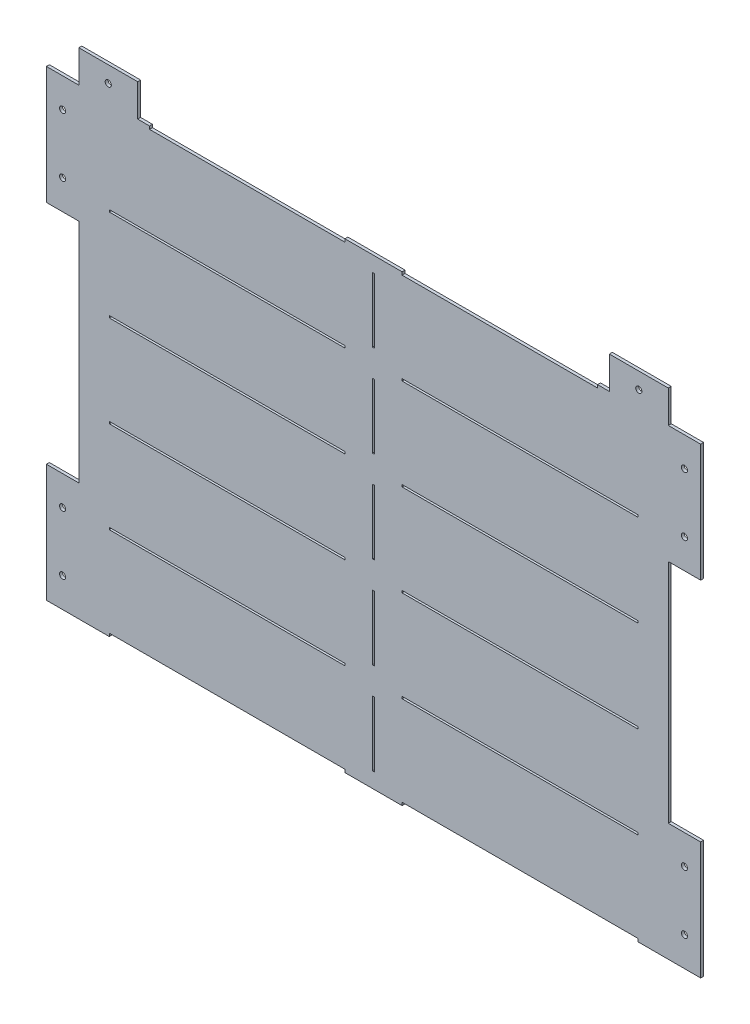
from build123d import *

# Parameters (mm, degrees)
MASTER_SKETCH_W         = 635.3556
MASTER_SKETCH_H         = 498.348
BOSS_EXTRUDE1_DEPTH     = 3.175
SKETCH2_W               = 34.925
SKETCH2_H               = 127
BOSS_EXTRUDE2_DEPTH     = 3.175
M6_CLEARANCE_HOLE1_D    = 6.6
MIRROR7_COPY_1_SKETCH_W = 34.925
MIRROR7_COPY_1_SKETCH_H = 127
MIRROR7_COPY_1_DEPTH    = 3.175
MIRROR7_COPY_2_D        = 6.6
SKETCH5_W               = 2.286
SKETCH5_H               = 69.85
CUT_EXTRUDE1_DEPTH      = 432.771348596
LPATTERN1_COUNT         = 5
LPATTERN1_PITCH         = 98.8568
SKETCH7_W               = 254
SKETCH7_H               = 2.286
CUT_EXTRUDE3_DEPTH      = 432.771348596
LPATTERN2_COUNT         = 4
LPATTERN2_PITCH         = 98.8568
MIRROR4_COPY_1_SKETCH_W = 254
MIRROR4_COPY_1_SKETCH_H = 2.286
MIRROR4_COPY_1_DEPTH    = 432.771348596
MIRROR4_COPY_2_SKETCH_W = 254
MIRROR4_COPY_2_SKETCH_H = 2.286
MIRROR4_COPY_2_DEPTH    = 432.771348596
MIRROR4_COPY_3_SKETCH_W = 254
MIRROR4_COPY_3_SKETCH_H = 2.286
MIRROR4_COPY_3_DEPTH    = 432.771348596
SKETCH10_W              = 63.5
SKETCH10_H              = 34.925
SKETCH10_R              = 3
BOSS_EXTRUDE3_DEPTH     = 3.175
M6_CLEARANCE_HOLE2_D    = 6.6
SKETCH6_W               = 210.6549
SKETCH6_H               = 3.175
SKETCH6_W_2             = 254
CUT_EXTRUDE2_DEPTH      = 453.825636414


with BuildPart() as part:
    # Master Sketch → Boss-Extrude1 (new body)
    with BuildSketch(Plane.XY):
        Rectangle(MASTER_SKETCH_W, MASTER_SKETCH_H)
    extrude(amount=BOSS_EXTRUDE1_DEPTH)

    # Sketch2 → Boss-Extrude2 (add)
    with BuildSketch(Plane.XY.offset(3.175)):
        with Locations((-335.1403, -185.674)):
            Rectangle(SKETCH2_W, SKETCH2_H)
    boss_extrude2 = extrude(amount=-BOSS_EXTRUDE2_DEPTH)

    # M6 Clearance Hole1 (through all)
    with Locations(Plane.XY.offset(3.175)):
        with Locations((-335.1403, -217.424), (-335.1403, -153.924)):
            m6_clearance_hole1 = Hole(M6_CLEARANCE_HOLE1_D / 2)

    # Mirror1: Boss-Extrude2, M6 Clearance Hole1 across plane
    add(boss_extrude2.mirror(Plane(origin=(0, 0, 0), x_dir=(0, 0, 1), z_dir=(1, 0, 0))))
    add(m6_clearance_hole1.mirror(Plane(origin=(0, 0, 0), x_dir=(0, 0, 1), z_dir=(1, 0, 0))), mode=Mode.SUBTRACT)

    # Mirror7: Boss-Extrude2, M6 Clearance Hole1 across plane
    add(boss_extrude2.mirror(Plane.ZX))
    add(m6_clearance_hole1.mirror(Plane.ZX), mode=Mode.SUBTRACT)

    # Mirror7 copy 1 sketch → Mirror7 copy 1 (add)
    with BuildSketch(Plane(origin=(0, 0, 3.175), x_dir=(-1, 0, 0), z_dir=(0, 0, 1))):
        with Locations((-335.1403, -185.674)):
            Rectangle(MIRROR7_COPY_1_SKETCH_W, MIRROR7_COPY_1_SKETCH_H)
    extrude(amount=-MIRROR7_COPY_1_DEPTH)

    # Mirror7 copy 2 (through all)
    with Locations(Plane(origin=(0, 0, 3.175), x_dir=(-1, 0, 0), z_dir=(0, 0, 1))):
        with Locations((-335.1403, -217.424), (-335.1403, -153.924)):
            Hole(MIRROR7_COPY_2_D / 2)

    # Sketch5 → Cut-Extrude1 (cut, through all)
    with BuildSketch(Plane.XY.offset(3.175)):
        with Locations((0, 197.7136)):
            Rectangle(SKETCH5_W, SKETCH5_H)
    cut_extrude1 = extrude(amount=-CUT_EXTRUDE1_DEPTH, mode=Mode.SUBTRACT)

    # LPattern1: Cut-Extrude1 ×5
    with Locations(*[(0, -i * LPATTERN1_PITCH, 0) for i in range(1, LPATTERN1_COUNT)]):
        add(cut_extrude1, mode=Mode.SUBTRACT)

    # Sketch7 → Cut-Extrude3 (cut, through all)
    with BuildSketch(Plane.XY.offset(3.175)):
        with Locations((-157.8229, 148.2852)):
            Rectangle(SKETCH7_W, SKETCH7_H)
    cut_extrude3 = extrude(amount=-CUT_EXTRUDE3_DEPTH, mode=Mode.SUBTRACT)

    # LPattern2: Cut-Extrude3 ×4
    with Locations(*[(0, -i * LPATTERN2_PITCH, 0) for i in range(1, LPATTERN2_COUNT)]):
        add(cut_extrude3, mode=Mode.SUBTRACT)

    # Mirror4: Cut-Extrude3 across plane
    add(cut_extrude3.mirror(Plane(origin=(0, 0, 0), x_dir=(0, 0, 1), z_dir=(1, 0, 0))), mode=Mode.SUBTRACT)

    # Mirror4 copy 1 sketch → Mirror4 copy 1 (cut, through all)
    with BuildSketch(Plane(origin=(0, -98.8568, 3.175), x_dir=(-1, 0, 0), z_dir=(0, 0, 1))):
        with Locations((-157.8229, -148.2852)):
            Rectangle(MIRROR4_COPY_1_SKETCH_W, MIRROR4_COPY_1_SKETCH_H)
    extrude(amount=-MIRROR4_COPY_1_DEPTH, mode=Mode.SUBTRACT)

    # Mirror4 copy 2 sketch → Mirror4 copy 2 (cut, through all)
    with BuildSketch(Plane(origin=(0, -197.7136, 3.175), x_dir=(-1, 0, 0), z_dir=(0, 0, 1))):
        with Locations((-157.8229, -148.2852)):
            Rectangle(MIRROR4_COPY_2_SKETCH_W, MIRROR4_COPY_2_SKETCH_H)
    extrude(amount=-MIRROR4_COPY_2_DEPTH, mode=Mode.SUBTRACT)

    # Mirror4 copy 3 sketch → Mirror4 copy 3 (cut, through all)
    with BuildSketch(Plane(origin=(0, -296.5704, 3.175), x_dir=(-1, 0, 0), z_dir=(0, 0, 1))):
        with Locations((-157.8229, -148.2852)):
            Rectangle(MIRROR4_COPY_3_SKETCH_W, MIRROR4_COPY_3_SKETCH_H)
    extrude(amount=-MIRROR4_COPY_3_DEPTH, mode=Mode.SUBTRACT)

    # Sketch10 → Boss-Extrude3 (add)
    with BuildSketch(Plane.XY.offset(3.175)):
        with Locations((-285.9278, 266.6365)):
            Rectangle(SKETCH10_W, SKETCH10_H)
        with Locations((-285.9278, 266.6365)):
            Circle(SKETCH10_R, mode=Mode.SUBTRACT)
    boss_extrude3 = extrude(amount=-BOSS_EXTRUDE3_DEPTH)

    # M6 Clearance Hole2 (through all)
    with Locations(Plane.XY.offset(3.175)):
        with Locations((-285.9278, 266.6365)):
            m6_clearance_hole2 = Hole(M6_CLEARANCE_HOLE2_D / 2)

    # Mirror6: Boss-Extrude3, M6 Clearance Hole2 across plane
    add(boss_extrude3.mirror(Plane(origin=(0, 0, 0), x_dir=(0, 0, 1), z_dir=(1, 0, 0))))
    add(m6_clearance_hole2.mirror(Plane(origin=(0, 0, 0), x_dir=(0, 0, 1), z_dir=(1, 0, 0))), mode=Mode.SUBTRACT)

    # Sketch6 → Cut-Extrude2 (cut, through all)
    with BuildSketch(Plane.XY.offset(3.175)):
        with Locations((-136.15035, 247.5865)):
            Rectangle(SKETCH6_W, SKETCH6_H)
        with Locations((136.15035, 247.5865)):
            Rectangle(SKETCH6_W, SKETCH6_H)
        with Locations((157.8229, -247.5865)):
            Rectangle(SKETCH6_W_2, SKETCH6_H)
        with Locations((-157.8229, -247.5865)):
            Rectangle(SKETCH6_W_2, SKETCH6_H)
    extrude(amount=-CUT_EXTRUDE2_DEPTH, mode=Mode.SUBTRACT)


solid = part.part
